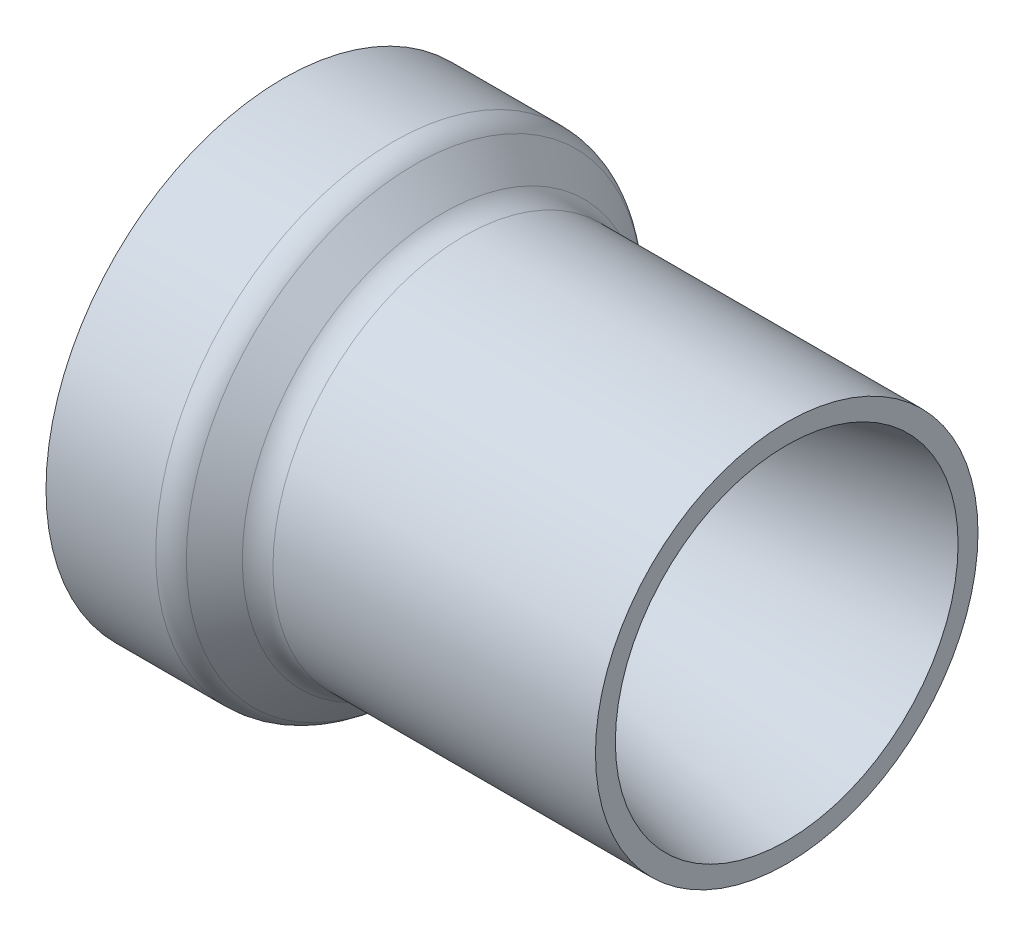
from build123d import *


with BuildPart() as part:
    # Sketch1 → Revolve1 (revolve)
    with BuildSketch(Plane.XY):
        with BuildLine():
            Line((104.479711473, 19.05), (104.479711473, 23.1775))
            Line((104.479711473, 23.1775), (20.831388127, 40.9575))
            Line((20.831388127, 40.9575), (14.481388127, 40.9575))
            Line((14.481388127, 40.9575), (0, 15.875))
            Line((0, 15.875), (0, 9.525))
            Line((0, 9.525), (22.769743879, 9.525))
            ThreePointArc((22.769743879, 9.525), (25.199783674, 10.008364969), (27.259871939, 11.384871939))
            Line((27.259871939, 11.384871939), (33.065128061, 17.190128061))
            ThreePointArc((33.065128061, 17.190128061), (35.125216326, 18.566635031), (37.555256121, 19.05))
            Line((37.555256121, 19.05), (104.479711473, 19.05))
        make_face()
    revolve(axis=Axis((0, 58.7375, 0), (1, 0, 0)))


solid = part.part
